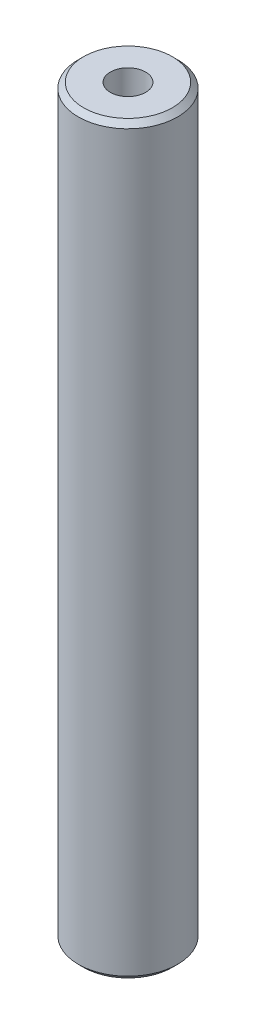
from build123d import *
from OCP.BRepFilletAPI import BRepFilletAPI_MakeChamfer

# Parameters (mm, degrees)
SKETCH1_R           = 40
BOSS_EXTRUDE1_DEPTH = 600
SKETCH2_R           = 14.235263406
CUT_EXTRUDE1_DEPTH  = 603.660766933
CHAMFER1_SIZE       = 4.258455373
CHAMFER1_SIZE2      = 4.261966232


with BuildPart() as part:
    # Sketch1 → Boss-Extrude1 (new body)
    with BuildSketch(Plane(origin=(0, 0, 0), x_dir=(1, 0, 0), z_dir=(0, 1, 0))):
        Circle(SKETCH1_R)
    extrude(amount=BOSS_EXTRUDE1_DEPTH)

    # Sketch2 → Cut-Extrude1 (cut, through all)
    with BuildSketch(Plane(origin=(0, 0, 0), x_dir=(1, 0, 0), z_dir=(0, 1, 0))):
        Circle(SKETCH2_R)
    extrude(amount=CUT_EXTRUDE1_DEPTH, mode=Mode.SUBTRACT)

    # Chamfer1: one chamfer whose edges measure the first distance from different faces: ONE call of the kernel's chamfer builder (chamfer() names one face for all edges)
    chamfer1_edges_1 = [part.edges().sort_by_distance(p)[0] for p in [
        (-40, 600, 0),
    ]]
    chamfer1_side_1 = [part.faces().sort_by_distance(p)[0] for p in [
        (-40, 300, 0),
    ]]
    chamfer1_edges_2 = [part.edges().sort_by_distance(p)[0] for p in [
        (-40, 0, 0),
    ]]
    chamfer1_side_2 = [part.faces().sort_by_distance(p)[0] for p in [
        (-38.86862915, 0, 0),
    ]]
    chamfer1 = BRepFilletAPI_MakeChamfer(part.part.solid().wrapped)
    for e in chamfer1_edges_1:
        chamfer1.Add(CHAMFER1_SIZE, CHAMFER1_SIZE2, e.wrapped, chamfer1_side_1[0].wrapped)  # the first distance lies on this face
    for e in chamfer1_edges_2:
        chamfer1.Add(CHAMFER1_SIZE, CHAMFER1_SIZE2, e.wrapped, chamfer1_side_2[0].wrapped)  # the first distance lies on this face
    add(Compound.cast(chamfer1.Shape()), mode=Mode.REPLACE)


solid = part.part
